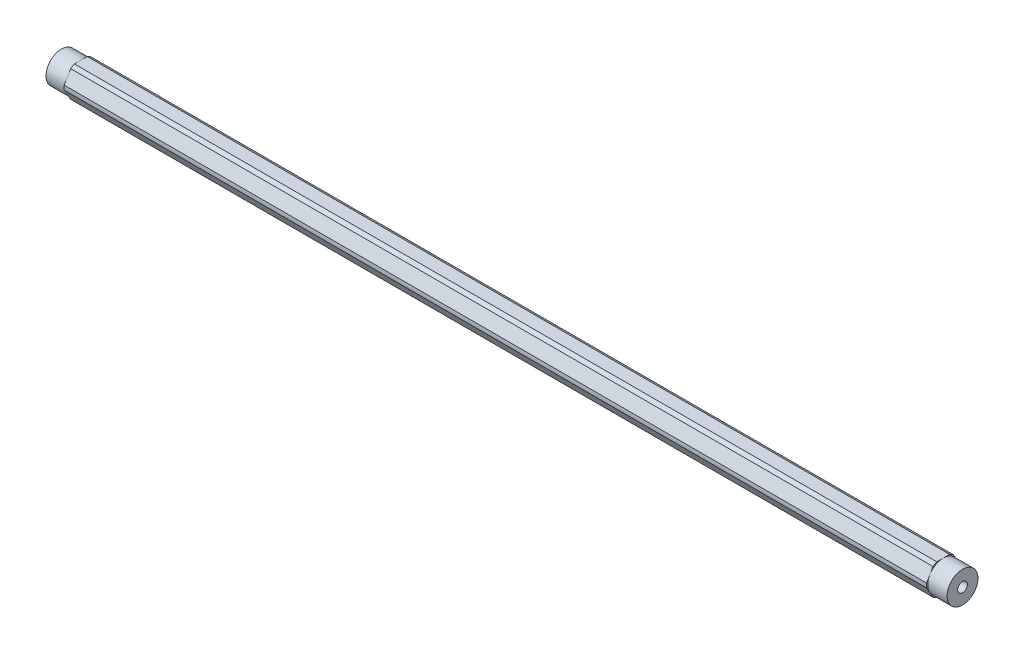
from build123d import *

# Parameters (mm, degrees)
SKETCH1_R                            = 2.0193
BOSS_EXTRUDE1_DEPTH                  = 184.94375
F_10_32_TAPPED_HOLE1_D               = 4.0386
F_10_32_TAPPED_HOLE1_DEPTH           = 16.34744
F_10_32_TAPPED_HOLE1_TIP             = 1.213317848
F_10_32_TAPPED_HOLE1_ON_FACE_2_D     = 4.0386
F_10_32_TAPPED_HOLE1_ON_FACE_2_DEPTH = 16.34744
F_10_32_TAPPED_HOLE1_ON_FACE_2_TIP   = 1.213317848
SKETCH3_R                            = 8.89
SKETCH3_R_2                          = 6.35
CUT_EXTRUDE_THIN1_DEPTH              = 7.9375


with BuildPart() as part:
    # Sketch1 → Boss-Extrude1 (new, symmetric)
    with BuildSketch(Plane(origin=(0, 0, 0), x_dir=(0, 0, -1), z_dir=(1, 0, 0))):
        with BuildLine():
            ThreePointArc((4.181770846, 5.456960429), (3.437499983, 5.953924622), (2.634980936, 6.35))
            Line((2.634980936, 6.35), (-2.634980936, 6.35))
            ThreePointArc((-2.634980936, 6.35), (-3.437499983, 5.953924622), (-4.181770846, 5.456960429))
            Line((-4.181770846, 5.456960429), (-6.816751782, 0.893039571))
            ThreePointArc((-6.816751782, 0.893039571), (-6.874999966, 0), (-6.816751782, -0.893039571))
            Line((-6.816751782, -0.893039571), (-4.181770846, -5.456960429))
            ThreePointArc((-4.181770846, -5.456960429), (-3.437499983, -5.953924622), (-2.634980936, -6.35))
            Line((-2.634980936, -6.35), (2.634980936, -6.35))
            ThreePointArc((2.634980936, -6.35), (3.437499983, -5.953924622), (4.181770846, -5.456960429))
            Line((4.181770846, -5.456960429), (6.816751782, -0.893039571))
            ThreePointArc((6.816751782, -0.893039571), (6.860422465, -0.447468582), (6.874999966, 0))
            ThreePointArc((6.874999966, 0), (6.860422465, 0.447468582), (6.816751782, 0.893039571))
            Line((6.816751782, 0.893039571), (4.181770846, 5.456960429))
        make_face()
        Circle(SKETCH1_R, mode=Mode.SUBTRACT)
    extrude(amount=BOSS_EXTRUDE1_DEPTH, both=True)

    # #10-32 Tapped Hole1
    with Locations(Plane(origin=(184.94375, 0, 0), x_dir=(0, 0, 1), z_dir=(1, 0, 0))):
        with Locations((0, 0)):
            Hole(F_10_32_TAPPED_HOLE1_D / 2, depth=F_10_32_TAPPED_HOLE1_DEPTH)
            with Locations((0, 0, -(F_10_32_TAPPED_HOLE1_DEPTH + F_10_32_TAPPED_HOLE1_TIP / 2))):  # 118° drill point
                Cone(0, F_10_32_TAPPED_HOLE1_D / 2, F_10_32_TAPPED_HOLE1_TIP, mode=Mode.SUBTRACT)

    # #10-32 Tapped Hole1 on face 2
    with Locations(Plane(origin=(-184.94375, 0, 0), x_dir=(0, 0, 1), z_dir=(1, 0, 0))):
        with Locations((0, 0)):
            Hole(F_10_32_TAPPED_HOLE1_ON_FACE_2_D / 2, depth=F_10_32_TAPPED_HOLE1_ON_FACE_2_DEPTH)
            with Locations((0, 0, -(F_10_32_TAPPED_HOLE1_ON_FACE_2_DEPTH + F_10_32_TAPPED_HOLE1_ON_FACE_2_TIP / 2))):  # 118° drill point
                Cone(0, F_10_32_TAPPED_HOLE1_ON_FACE_2_D / 2, F_10_32_TAPPED_HOLE1_ON_FACE_2_TIP, mode=Mode.SUBTRACT)

    # Sketch3 → Cut-Extrude-Thin1 (cut)
    with BuildSketch(Plane(origin=(184.94375, 0, 0), x_dir=(0, 0, -1), z_dir=(1, 0, 0))):
        Circle(SKETCH3_R)
        Circle(SKETCH3_R_2, mode=Mode.SUBTRACT)
    cut_extrude_thin1 = extrude(amount=-CUT_EXTRUDE_THIN1_DEPTH, mode=Mode.SUBTRACT)

    # Mirror1: Cut-Extrude-Thin1 across plane
    add(cut_extrude_thin1.mirror(Plane(origin=(0, 0, 0), x_dir=(0, 0, 1), z_dir=(1, 0, 0))), mode=Mode.SUBTRACT)


solid = part.part
